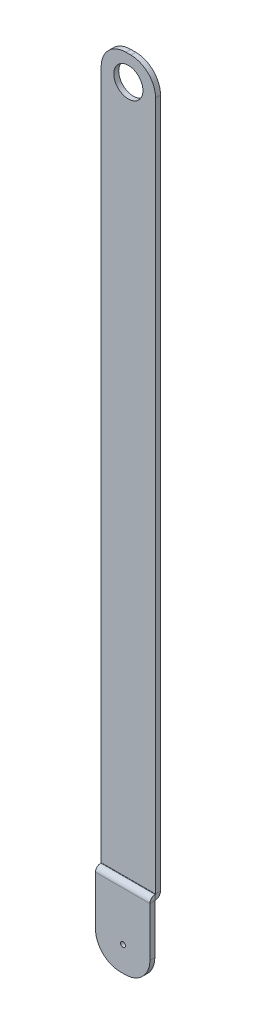
from build123d import *

# Parameters (mm, degrees)
BASE_FLANGE1_DEPTH      = 11
FILLET1_R               = 10
CUT_EXTRUDE1_DEPTH      = 290.218332925
CUT_EXTRUDE1_DEPTH_BACK = 290.218332925
SKETCH7_R               = 5.894184215
SKETCH7_R_2             = 1
BODY_MOVE_COPY1_ANGLE   = 120


# Sheet-metal steps are written as plain solids
with BuildPart() as part:
    # Sketch2 → Base-Flange1 (new, symmetric)
    with BuildSketch(Plane.XY):
        with BuildLine():
            Line((-289, 0), (-0.1, 0))
            ThreePointArc((-0.1, 0), (-0.029289322, 0.029289322), (0, 0.1))
            Line((0, 0.1), (0, 0.19))
            ThreePointArc((0, 0.19), (0.61507576, 1.67492424), (2.1, 2.29))
            Line((2.1, 2.29), (32, 2.29))
            Line((32, 2.29), (32, 0.29))
            Line((32, 0.29), (2.1, 0.29))
            ThreePointArc((2.1, 0.29), (2.029289322, 0.260710678), (2, 0.19))
            Line((2, 0.19), (2, 0.1))
            ThreePointArc((2, 0.1), (1.38492424, -1.38492424), (-0.1, -2))
            Line((-0.1, -2), (-289, -2))
            Line((-289, -2), (-289, 0))
        make_face()
    extrude(amount=BASE_FLANGE1_DEPTH, both=True)

    # Fillet1
    fillet1_edges = [part.edges().sort_by_distance(p)[0] for p in [
        (-289, -1, -11),
        (32, 1.29, -11),
        (-289, -1, 11),
        (32, 1.29, 11),
    ]]
    fillet(fillet1_edges, radius=FILLET1_R)

    # Sketch7 → Cut-Extrude1 (cut, two sides: drawn at the far end of the back side and taken through both)
    with BuildSketch(Plane(origin=(0, 0, 0), x_dir=(1, 0, 0), z_dir=(0, 1, 0)).offset(-CUT_EXTRUDE1_DEPTH_BACK)):
        with Locations(Location((-279, 0, 0), (0, 0, 270))):
            Circle(SKETCH7_R)
        with Locations(Location((21.883026743, 0.116566496, 0), (0, 0, 270))):
            Circle(SKETCH7_R_2)
    extrude(amount=CUT_EXTRUDE1_DEPTH + CUT_EXTRUDE1_DEPTH_BACK, mode=Mode.SUBTRACT)


with BuildPart() as part_1:
    # Body-Move/Copy1: moved
    add(part.part.moved(Location((0, 0, 0))).rotate(Axis((-95.951666667, -47.903333333, -48.048333333), (0.5773502691899637, -0.5773502691896031, -0.5773502691893106)), BODY_MOVE_COPY1_ANGLE))


solid = part_1.part
